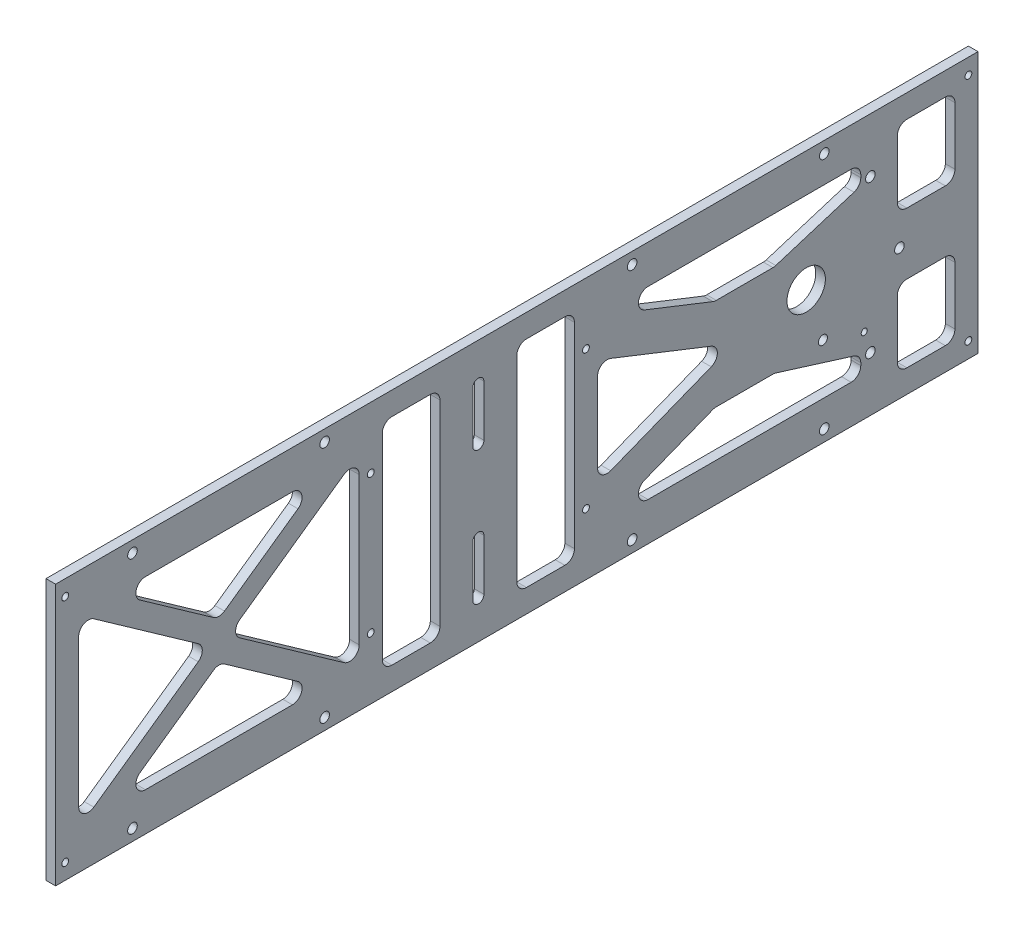
from build123d import *

# Parameters (mm, degrees)
SKETCH1_W                               = 304.8
SKETCH1_H                               = 86.36
BOSS_EXTRUDE1_DEPTH                     = 3.175
F_1_8_0_125_PRESS_DOWEL_HOLE1_OUTLINE_R = 1.5875
F_1_8_0_125_PRESS_DOWEL_HOLE1_DEPTH     = 3.175
CUT_EXTRUDE1_DEPTH                      = 317.814094107
SKETCH7_W                               = 19.05
SKETCH7_H                               = 25.4
SKETCH7_H_2                             = 71.12
CUT_EXTRUDE2_DEPTH                      = 317.814094107
FILLET1_R                               = 3.175
F_1_2_0_5_PRESS_DOWEL_HOLE1_D           = 12.7
F_3_0MM_PRESS_DOWEL_HOLE1_D             = 3
F_3_0MM_PRESS_DOWEL_HOLE1_DEPTH         = 3.175
F_3_0MM_PRESS_DOWEL_HOLE1_TIP           = 0.901290929
F_2_0MM_PRESS_DOWEL_HOLE1_D             = 2
F_2_0MM_PRESS_DOWEL_HOLE1_DEPTH         = 3.175
F_2_0MM_PRESS_DOWEL_HOLE1_TIP           = 0.600860619
F_4_40_TAPPED_HOLE2_D                   = 2.2606
F_1_8_0_125_DIAMETER_HOLE1_D            = 3.175


# Read off the part's stored shape, not the designer's step: 1/8 (0.125) Press Dowel Hole1
with BuildPart() as part:
    # Sketch1 → Boss-Extrude1 (new body)
    with BuildSketch(Plane(origin=(0, 0, 0), x_dir=(0, 0, -1), z_dir=(1, 0, 0))):
        with Locations((152.4, 43.18)):
            Rectangle(SKETCH1_W, SKETCH1_H)
    extrude(amount=BOSS_EXTRUDE1_DEPTH)

    # 1/8 (0.125) Press Dowel Hole1 outline → 1/8 (0.125) Press Dowel Hole1 (cut)
    with BuildSketch(Plane.YZ):
        with Locations((68.36, -269.24)):
            Circle(F_1_8_0_125_PRESS_DOWEL_HOLE1_OUTLINE_R)
        with Locations((18, -269.24)):
            Circle(F_1_8_0_125_PRESS_DOWEL_HOLE1_OUTLINE_R)
        with Locations((82.55, -25.4)):
            Circle(F_1_8_0_125_PRESS_DOWEL_HOLE1_OUTLINE_R)
        with Locations((82.55, -88.9)):
            Circle(F_1_8_0_125_PRESS_DOWEL_HOLE1_OUTLINE_R)
        with Locations((82.55, -190.5)):
            Circle(F_1_8_0_125_PRESS_DOWEL_HOLE1_OUTLINE_R)
        with Locations((82.55, -254)):
            Circle(F_1_8_0_125_PRESS_DOWEL_HOLE1_OUTLINE_R)
        with Locations((3.81, -254)):
            Circle(F_1_8_0_125_PRESS_DOWEL_HOLE1_OUTLINE_R)
        with Locations((3.81, -190.5)):
            Circle(F_1_8_0_125_PRESS_DOWEL_HOLE1_OUTLINE_R)
        with Locations((3.81, -88.9)):
            Circle(F_1_8_0_125_PRESS_DOWEL_HOLE1_OUTLINE_R)
        with Locations((3.81, -25.4)):
            Circle(F_1_8_0_125_PRESS_DOWEL_HOLE1_OUTLINE_R)
    extrude(amount=F_1_8_0_125_PRESS_DOWEL_HOLE1_DEPTH, mode=Mode.SUBTRACT)

    # Sketch6 → Cut-Extrude1 (cut, through all)
    with BuildSketch(Plane(origin=(3.175, 0, 0), x_dir=(0, 0, -1), z_dir=(1, 0, 0))):
        with BuildLine():
            Line((141.5288, 73.66), (141.5288, 56.781492032))
            ThreePointArc((141.5288, 56.781492032), (139.7, 54.952692032), (137.8712, 56.781492032))
            Line((137.8712, 56.781492032), (137.8712, 73.66))
            ThreePointArc((137.8712, 73.66), (139.7, 75.4888), (141.5288, 73.66))
        make_face()
        with BuildLine():
            Line((141.5288, 12.7), (141.5288, 29.578507968))
            ThreePointArc((141.5288, 29.578507968), (139.7, 31.407307968), (137.8712, 29.578507968))
            Line((137.8712, 29.578507968), (137.8712, 12.7))
            ThreePointArc((137.8712, 12.7), (139.7, 10.8712), (141.5288, 12.7))
        make_face()
    extrude(amount=-CUT_EXTRUDE1_DEPTH, mode=Mode.SUBTRACT)

    # Sketch7 → Cut-Extrude2 (cut, through all)
    with BuildSketch(Plane(origin=(3.175, 0, 0), x_dir=(0, 0, -1), z_dir=(1, 0, 0))):
        Polygon((7.62, 73.66), (7.62, 12.7), (50.8, 43.18), align=None)
        with Locations((287.655, 66.04)):
            Rectangle(SKETCH7_W, SKETCH7_H)
        Polygon((100.33, 12.7), (57.15, 43.18), (100.33, 73.66), align=None)
        with Locations((161.925, 43.18)):
            Rectangle(SKETCH7_W, SKETCH7_H_2)
        Polygon((179.07, 25.4), (224.15112849, 43.18), (179.07, 60.96), align=None)
        Polygon((53.975, 73.66), (88.265, 73.66), (53.975, 49.455294118), (19.685, 73.66), align=None)
        Polygon((53.975, 36.904705882), (19.685, 12.7), (53.975, 12.7), (88.265, 12.7), align=None)
        Polygon((179.07, 12.7), (217.710967277, 27.94), (237.51919806, 27.94), (266.065, 19.05), (266.065, 12.7), (225.425, 12.7), align=None)
        Polygon((217.710967277, 58.42), (237.51919806, 58.42), (266.065, 67.31), (266.065, 73.66), (225.425, 73.66), (179.07, 73.66), align=None)
        with Locations((287.655, 20.32)):
            Rectangle(SKETCH7_W, SKETCH7_H)
        with Locations((117.475, 43.18)):
            Rectangle(SKETCH7_W, SKETCH7_H_2)
    extrude(amount=-CUT_EXTRUDE2_DEPTH, mode=Mode.SUBTRACT)

    # Fillet1
    fillet1_edges = [part.edges().sort_by_distance(p)[0] for p in [
        (1.5875, 73.66, -7.62),
        (1.5875, 43.18, -50.8),
        (1.5875, 12.7, -7.62),
        (1.5875, 53.34, -278.13),
        (1.5875, 78.74, -278.13),
        (1.5875, 78.74, -297.18),
        (1.5875, 53.34, -297.18),
        (1.5875, 73.66, -100.33),
        (1.5875, 12.7, -100.33),
        (1.5875, 43.18, -57.15),
        (1.5875, 12.7, -179.07),
        (1.5875, 27.94, -217.710967277),
        (1.5875, 27.94, -237.51919806),
        (1.5875, 19.05, -266.065),
        (1.5875, 12.7, -266.065),
        (1.5875, 25.4, -179.07),
        (1.5875, 60.96, -179.07),
        (1.5875, 43.18, -224.15112849),
        (1.5875, 73.66, -19.685),
        (1.5875, 73.66, -88.265),
        (1.5875, 49.455294118, -53.975),
        (1.5875, 36.904705882, -53.975),
        (1.5875, 12.7, -88.265),
        (1.5875, 12.7, -19.685),
        (1.5875, 73.66, -266.065),
        (1.5875, 67.31, -266.065),
        (1.5875, 58.42, -237.51919806),
        (1.5875, 58.42, -217.710967277),
        (1.5875, 73.66, -179.07),
        (1.5875, 7.62, -152.4),
        (1.5875, 78.74, -152.4),
        (1.5875, 78.74, -171.45),
        (1.5875, 7.62, -171.45),
        (1.5875, 7.62, -278.13),
        (1.5875, 33.02, -278.13),
        (1.5875, 33.02, -297.18),
        (1.5875, 7.62, -297.18),
        (1.5875, 7.62, -107.95),
        (1.5875, 78.74, -107.95),
        (1.5875, 78.74, -127),
        (1.5875, 7.62, -127),
    ]]
    fillet(fillet1_edges, radius=FILLET1_R)

    # 1/2 (0.5) Press Dowel Hole1 (through all)
    with Locations(Plane.ZY):
        with Locations((-248.01972494, 46.53348834)):
            Hole(F_1_2_0_5_PRESS_DOWEL_HOLE1_D / 2)

    # Ø3.0mm Press Dowel Hole1
    with Locations(Plane.ZY):
        with Locations((-253.55249518, 29.46260554)):
            Hole(F_3_0MM_PRESS_DOWEL_HOLE1_D / 2, depth=F_3_0MM_PRESS_DOWEL_HOLE1_DEPTH)
            with Locations((0, 0, -(F_3_0MM_PRESS_DOWEL_HOLE1_DEPTH + F_3_0MM_PRESS_DOWEL_HOLE1_TIP / 2))):  # 118° drill point
                Cone(0, F_3_0MM_PRESS_DOWEL_HOLE1_D / 2, F_3_0MM_PRESS_DOWEL_HOLE1_TIP, mode=Mode.SUBTRACT)

    # Ø2.0mm Press Dowel Hole1
    with Locations(Plane.ZY):
        with Locations((-267.20941224, 24.95127344)):
            Hole(F_2_0MM_PRESS_DOWEL_HOLE1_D / 2, depth=F_2_0MM_PRESS_DOWEL_HOLE1_DEPTH)
            with Locations((0, 0, -(F_2_0MM_PRESS_DOWEL_HOLE1_DEPTH + F_2_0MM_PRESS_DOWEL_HOLE1_TIP / 2))):  # 118° drill point
                Cone(0, F_2_0MM_PRESS_DOWEL_HOLE1_D / 2, F_2_0MM_PRESS_DOWEL_HOLE1_TIP, mode=Mode.SUBTRACT)

    # #4-40 Tapped Hole2 (through all)
    with Locations(Plane(origin=(3.175, 0, 0), x_dir=(0, 0, -1), z_dir=(1, 0, 0))):
        with Locations((301.625, 81.2038), (301.625, 5.1562), (3.175, 81.2038), (3.175, 5.1562), (175.26, 66.04), (175.26, 20.32), (104.14, 66.04), (104.14, 20.32)):
            Hole(F_4_40_TAPPED_HOLE2_D / 2)

    # 1/8 (0.125) Diameter Hole1 (through all)
    with Locations(Plane(origin=(3.175, 0, 0), x_dir=(0, 0, -1), z_dir=(1, 0, 0))):
        with Locations((278.835955069, 43.18)):
            Hole(F_1_8_0_125_DIAMETER_HOLE1_D / 2)


solid = part.part
